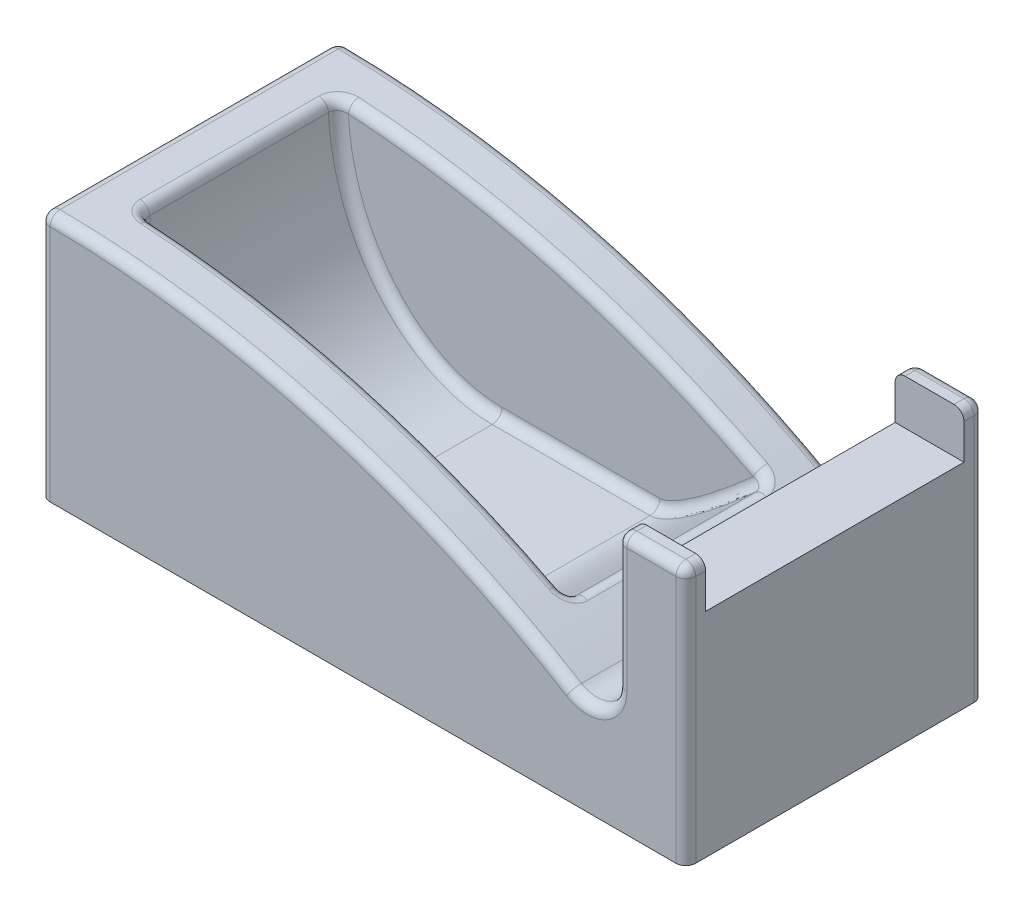
from build123d import *

# Parameters (mm, degrees)
BOSS_EXTRUDE1_DEPTH     = 15
CUT_EXTRUDE1_REACH      = 70.061
SKETCH2_W               = 26
SKETCH2_H               = 4.536123031
FILLET1_R               = 1
CUT_EXTRUDE2_REACH      = 51.241
CUT_EXTRUDE2_END_RADIUS = 102.578893437
CUT_EXTRUDE2_START      = -5
SKETCH3_W               = 43.505117415
SKETCH3_H               = 20
FILLET2_START           = -10
FILLET2_DEPTH           = 20
FILLET3_R               = 1


with BuildPart() as part:
    # Sketch1 → Boss-Extrude1 (new, symmetric)
    with BuildSketch(Plane.XY):
        with BuildLine():
            Line((-32.5, 12.5), (-32.5, -12.5))
            Line((-32.5, -12.5), (32.5, -12.5))
            Line((32.5, -12.5), (32.5, 12.5))
            ThreePointArc((32.5, 12.5), (32.207106781, 13.207106781), (31.5, 13.5))
            Line((31.5, 13.5), (26.569916439, 13.5))
            ThreePointArc((26.569916439, 13.5), (25.862809657, 13.207106781), (25.569916439, 12.5))
            Line((25.569916439, 12.5), (25.569916439, 0))
            ThreePointArc((25.569916439, 0), (24.037159249, -2.616715218), (21.005117415, -2.559571061))
            ThreePointArc((21.005117415, -2.559571061), (-4.707967553, 8.663358468), (-32.5, 12.5))
        make_face()
    extrude(amount=BOSS_EXTRUDE1_DEPTH, both=True)

    # Cut-Extrude1: up to this face of the body (flat: up to its plane)
    cut_extrude1_end = Plane(part.part.faces().sort_by_distance((25.569916439, 6.25, 0))[0])
    # Sketch2 → Cut-Extrude1 (cut, up to the picked face)
    with BuildSketch(Plane(origin=(32.5, 0, 0), x_dir=(0, 0, -1), z_dir=(1, 0, 0)), mode=Mode.PRIVATE) as cut_extrude1_sk1:
        with Locations((0, 11.231938485)):
            Rectangle(SKETCH2_W, SKETCH2_H)
    cut_extrude1_tool1 = split(extrude(cut_extrude1_sk1.sketch, amount=-CUT_EXTRUDE1_REACH, mode=Mode.PRIVATE), bisect_by=cut_extrude1_end, keep=Keep.BOTH, mode=Mode.PRIVATE)
    add(cut_extrude1_tool1.solids().sort_by(Axis((32.5, 11.231938, 0), (-1, 0, 0)))[0], mode=Mode.SUBTRACT)

    # Fillet1
    fillet1_edges = [part.edges().sort_by_distance(p)[0] for p in [
        (32.207106781, 13.207106781, -15),
        (32.5, 0, -15),
        (-32.5, 0, -15),
        (-4.707967553, 8.663358468, -15),
        (32.5, 0, 15),
        (-32.5, 12.5, 0),
        (32.207106781, 13.207106781, 15),
        (29.034958219, 13.5, 15),
        (25.862809657, 13.207106781, 15),
        (25.569916439, 6.25, 15),
        (24.037159249, -2.616715218, 15),
        (-4.707967553, 8.663358468, 15),
        (-32.5, 0, 15),
        (24.037159249, -2.616715218, -15),
        (25.569916439, 6.25, -15),
        (25.862809657, 13.207106781, -15),
        (29.034958219, 13.5, -15),
    ]]
    fillet(fillet1_edges, radius=FILLET1_R)

    # Cut-Extrude2: up to this cylinder (the profile starts inside it)
    cut_extrude2_end = Plane(origin=(-32.5, -90.078893437, 0), z_dir=(0, 0, -1)) * Cylinder(CUT_EXTRUDE2_END_RADIUS, 308.639786874, mode=Mode.PRIVATE)
    # Sketch3 → Cut-Extrude2 (cut, up to the surface)
    with BuildSketch(Plane.XZ.offset(12.5).offset(CUT_EXTRUDE2_START), mode=Mode.PRIVATE) as cut_extrude2_sk1:
        with Locations((-5.747441292, 0)):
            Rectangle(SKETCH3_W, SKETCH3_H)
    cut_extrude2_tool1 = extrude(cut_extrude2_sk1.sketch, amount=-CUT_EXTRUDE2_REACH, mode=Mode.PRIVATE) & cut_extrude2_end
    add(cut_extrude2_tool1.solids().sort_by_distance((-5.747441, -7.5, 0))[0], mode=Mode.SUBTRACT)

    # Fillet2: read off the stored shape, not the designer's step
    # Fillet2 outline → Fillet2 (add)
    with BuildSketch(Plane.XY.offset(FILLET2_START)):
        with BuildLine():
            Line((-27.5, -7.5), (-11.000450518, -7.5))
            add(Edge.make_bspline(
                [(-11.000450518, -7.5), (-27.353103204, -7.5), (-27.5, 12.378070108)],
                knots=[0, 0, 0, 1, 1, 1], degree=2, weights=[1, 0.709714622, 1]))
            Line((-27.5, 12.378070108), (-27.5, -7.5))
        make_face()
        with BuildLine():
            add(Edge.make_bspline(
                [(4.887985159, -7.5), (7.442430078, -7.5), (16.005117415, 0.3074051)],
                knots=[0, 0, 0, 1, 1, 1], degree=2, weights=[1, 0.932455132, 1]))
            Line((4.887985159, -7.5), (16.005117415, -7.5))
            Line((16.005117415, -7.5), (16.005117415, 0.3074051))
        make_face()
    extrude(amount=FILLET2_DEPTH)

    # Fillet3
    fillet3_edges = [part.edges().sort_by_distance(p)[0] for p in [
        (10.788036453, -4.146835823, 10),
        (-23.15990982, -0.996622692, 10),
        (10.788036453, -4.146835823, -10),
        (-23.15990982, -0.996622692, -10),
        (-5.075109192, 8.765958442, 10),
        (-5.075109192, 8.765958442, -10),
        (16.005117415, 0.3074051, 0),
        (-27.5, 12.378070108, 0),
        (-3.056232679, -7.5, 10),
        (-3.056232679, -7.5, -10),
    ]]
    fillet(fillet3_edges, radius=FILLET3_R)


solid = part.part
